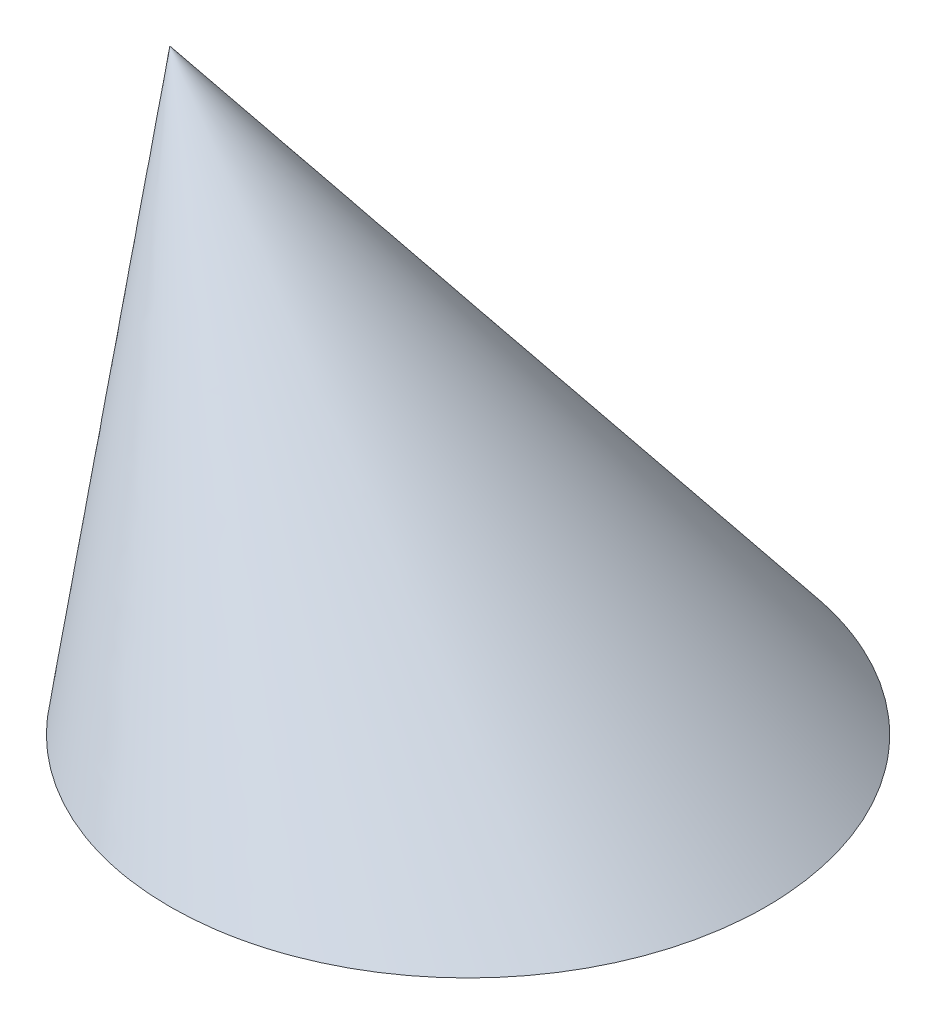
from build123d import *

# Parameters (mm, degrees)
SKETCH_1_R = 1000


with BuildPart() as part:
    # 草图1 → 放样1 section 0
    with BuildSketch(Plane(origin=(0, 0, 0), x_dir=(1, 0, 0), z_dir=(0, 1, 0)), mode=Mode.PRIVATE) as loft_1_s0:
        Circle(SKETCH_1_R)
    loft([loft_1_s0.sketch, Vertex(-1000, 1500, 0)])


solid = part.part
